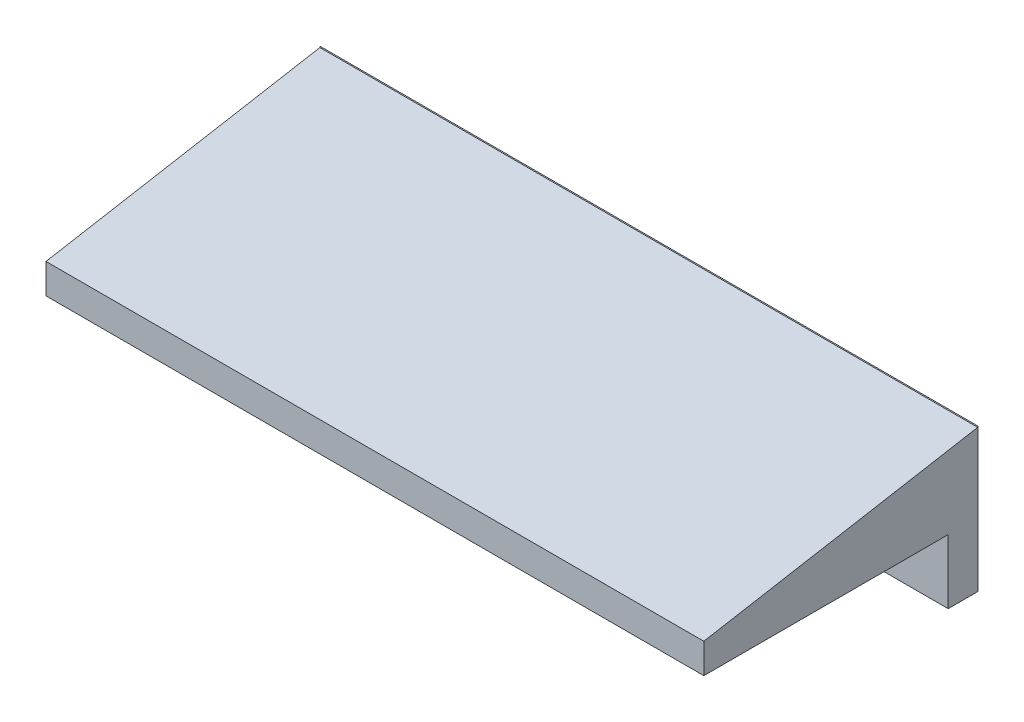
from build123d import *

# Parameters (mm, degrees)
SKETCH1_W           = 70
SKETCH1_H           = 26
BOSS_EXTRUDE1_DEPTH = 3.175
SKETCH2_W           = 70
SKETCH2_H           = 10
BOSS_EXTRUDE2_DEPTH = 3.175
SKETCH3_R           = 1.6
CUT_EXTRUDE1_DEPTH  = 3.175
BOSS_EXTRUDE3_DEPTH = 70
SKETCH5_W           = 28
SKETCH5_H           = 6.825
CUT_EXTRUDE2_DEPTH  = 10


with BuildPart() as part:
    # Sketch1 → Boss-Extrude1 (new body)
    with BuildSketch(Plane(origin=(0, 0, 0), x_dir=(1, 0, 0), z_dir=(0, 1, 0))):
        Rectangle(SKETCH1_W, SKETCH1_H)
    extrude(amount=BOSS_EXTRUDE1_DEPTH)

    # Sketch2 → Boss-Extrude2 (add)
    with BuildSketch(Plane(origin=(0, 0, -13), x_dir=(-1, 0, 0), z_dir=(0, 0, -1))):
        with Locations((0, -1.825)):
            Rectangle(SKETCH2_W, SKETCH2_H)
    extrude(amount=BOSS_EXTRUDE2_DEPTH)

    # Sketch3 → Cut-Extrude1 (cut)
    with BuildSketch(Plane.XY.offset(-13)):
        with Locations((-14.914, -3.825)):
            Circle(SKETCH3_R)
        with Locations((28.575, -3.825)):
            Circle(SKETCH3_R)
        with Locations((-28.575, -3.825)):
            Circle(SKETCH3_R)
    extrude(amount=-CUT_EXTRUDE1_DEPTH, mode=Mode.SUBTRACT)

    # Sketch4 → Boss-Extrude3 (add)
    with BuildSketch(Plane(origin=(35, 0, 0), x_dir=(0, 0, -1), z_dir=(1, 0, 0))):
        Polygon((16.143192443, 8.313731132), (-13, 3.175), (16.175, 3.175), (16.175, 8.412812241), align=None)
    extrude(amount=-BOSS_EXTRUDE3_DEPTH)

    # Sketch5 → Cut-Extrude2 (cut)
    with BuildSketch(Plane(origin=(0, 0, -16.175), x_dir=(-1, 0, 0), z_dir=(0, 0, -1))):
        with Locations((-11, -3.4125)):
            Rectangle(SKETCH5_W, SKETCH5_H)
    extrude(amount=-CUT_EXTRUDE2_DEPTH, mode=Mode.SUBTRACT)


solid = part.part
